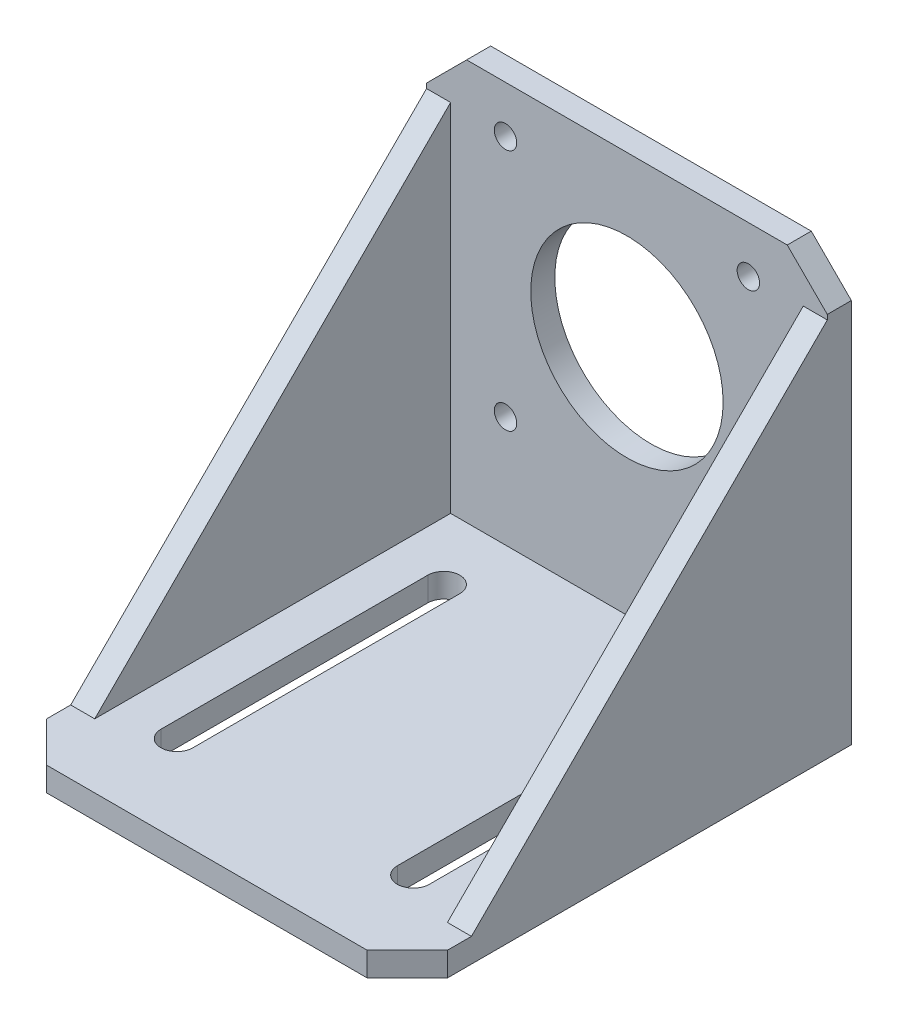
from build123d import *

# Parameters (mm, degrees)
CROQUIS1_R              = 12
SALIENTE_EXTRUIR2_DEPTH = 3
CROQUIS2_R              = 1.4
CORTAR_EXTRUIR1_DEPTH   = 41.718546143
CROQUIS3_W              = 50
CROQUIS3_H              = 3
SALIENTE_EXTRUIR3_DEPTH = 52.4
CORTAR_EXTRUIR2_DEPTH   = 81.64217259
SALIENTE_EXTRUIR4_DEPTH = 3


with BuildPart() as part:
    # Croquis1 → Saliente-Extruir2 (new body)
    with BuildSketch(Plane.XY):
        Polygon((20, 21), (-20, 21), (-25, 16), (-25, -32), (25, -32), (25, 16), align=None)
        Circle(CROQUIS1_R, mode=Mode.SUBTRACT)
    extrude(amount=SALIENTE_EXTRUIR2_DEPTH)

    # Croquis2 → Cortar-Extruir1 (cut, through all)
    with BuildSketch(Plane.XY.offset(3)):
        with Locations((-15.15, 15.15)):
            Circle(CROQUIS2_R)
        with Locations((15.15, 15.15)):
            Circle(CROQUIS2_R)
        with Locations((15.15, -15.15)):
            Circle(CROQUIS2_R)
        with Locations((-15.15, -15.15)):
            Circle(CROQUIS2_R)
    extrude(amount=-CORTAR_EXTRUIR1_DEPTH, mode=Mode.SUBTRACT)

    # Croquis3 → Saliente-Extruir3 (add)
    with BuildSketch(Plane.XY.offset(3)):
        with Locations((0, -30.5)):
            Rectangle(CROQUIS3_W, CROQUIS3_H)
    extrude(amount=SALIENTE_EXTRUIR3_DEPTH)

    # Croquis4 → Cortar-Extruir2 (cut, through all)
    with BuildSketch(Plane.XZ.offset(32)):
        Polygon((-25, 50.4), (-20, 55.4), (-25, 55.4), align=None)
        with BuildLine():
            Line((-16.75, 44.4), (-16.75, 11.1))
            ThreePointArc((-16.75, 11.1), (-14.75, 9.1), (-12.75, 11.1))
            Line((-12.75, 11.1), (-12.75, 44.4))
            ThreePointArc((-12.75, 44.4), (-14.75, 46.4), (-16.75, 44.4))
        make_face()
        with BuildLine():
            Line((12.75, 44.4), (12.75, 11.1))
            ThreePointArc((12.75, 11.1), (14.75, 9.1), (16.75, 11.1))
            Line((16.75, 11.1), (16.75, 44.4))
            ThreePointArc((16.75, 44.4), (14.75, 46.4), (12.75, 44.4))
        make_face()
        Polygon((25, 55.4), (25, 50.4), (20, 55.4), align=None)
    extrude(amount=-CORTAR_EXTRUIR2_DEPTH, mode=Mode.SUBTRACT)

    # Croquis5 → Saliente-Extruir4 (add)
    with BuildSketch(Plane.ZY.offset(25)):
        Polygon((3, 15.4), (3, -29), (47.4, -29), align=None)
    saliente_extruir4 = extrude(amount=-SALIENTE_EXTRUIR4_DEPTH)

    # Simetría1: Saliente-Extruir4 across plane
    add(saliente_extruir4.mirror(Plane(origin=(0, 0, 0), x_dir=(0, 0, 1), z_dir=(1, 0, 0))))


solid = part.part
